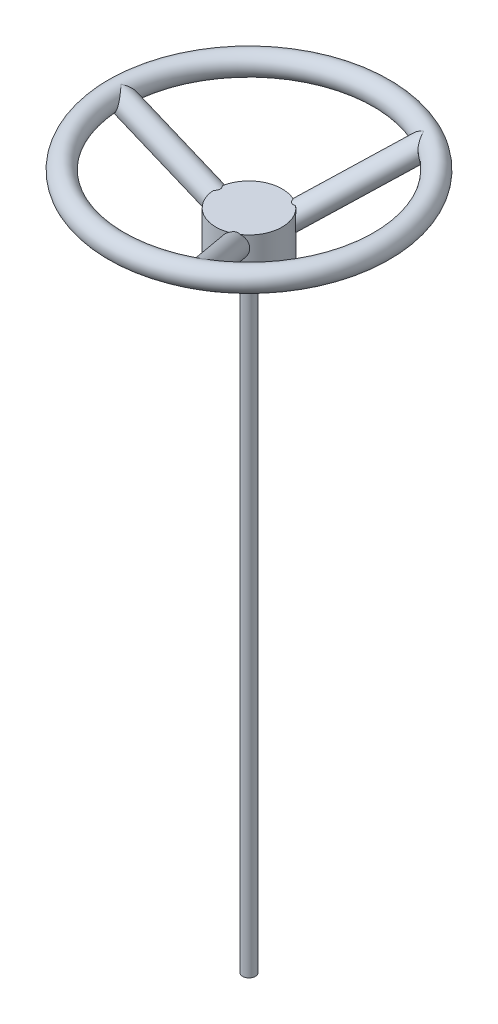
from build123d import *

# Parameters (mm, degrees)
SKETCH1_R           = 12.7
SKETCH4_R           = 38.1
BOSS_EXTRUDE1_DEPTH = 50.8
SWEEP1_PROFILE_R    = 12.7
SKETCH13_R          = 12.7
BOSS_EXTRUDE2_DEPTH = 50.8
CIRPATTERN1_COUNT   = 3
SKETCH20_R          = 7.3025
BOSS_EXTRUDE3_DEPTH = 711.2


with BuildPart() as part:
    # Sketch1 → Revolve1 (revolve)
    with BuildSketch(Plane.XY):
        Circle(SKETCH1_R)
    revolve(axis=Axis((152.4, -24.171508172, 0), (0, 1, 0)))



with BuildPart() as body_2:
    # Sketch4 → Boss-Extrude1 (new body)
    with BuildSketch(Plane(origin=(0, -38.1, 0), x_dir=(1, 0, 0), z_dir=(0, 1, 0))):
        with Locations((152.4, 0)):
            Circle(SKETCH4_R)
    extrude(amount=-BOSS_EXTRUDE1_DEPTH)


with BuildPart() as part_1:
    add(part.part)

    add(body_2.part)  # Sweep1 merges body 2
    # Sweep1: sweep along a curve in space
    with BuildLine() as sweep1_path:
        Line((114.368989505, -50.8, -2.291776762), (0, 0, 0))
    # Sweep1 profile (on start of the path) → Sweep1 (sweep)
    with BuildSketch(Plane(origin=(114.368989505, -50.8, -2.291776762), x_dir=(-0.4059338560019131, -0.9139024589918872, 0), z_dir=(-0.9137492485462624, 0.4058658035458109, 0.01831011450685407))):
        Circle(SWEEP1_PROFILE_R)
    sweep1 = sweep(path=sweep1_path.line)

    # Sketch13 → Boss-Extrude2 (add)
    with BuildSketch(Plane(origin=(114.368989505, -50.8, -2.291776762), x_dir=(-0.016733658672236966, 0.007432695385603842, -0.9998323558010842), z_dir=(0.9137492485462625, -0.40586580354581087, -0.01831011450685408))):
        Circle(SKETCH13_R)
    boss_extrude2 = extrude(amount=BOSS_EXTRUDE2_DEPTH)

    # CirPattern1: Sweep1, Boss-Extrude2 ×3 about axis
    cirpattern1_axis = Axis((152.4, -38.1, 0), (0, 1, 0))
    add([sweep1.rotate(cirpattern1_axis, i * 360 / CIRPATTERN1_COUNT) for i in range(1, CIRPATTERN1_COUNT)])
    add([boss_extrude2.rotate(cirpattern1_axis, i * 360 / CIRPATTERN1_COUNT) for i in range(1, CIRPATTERN1_COUNT)])

    # Sketch20 → Boss-Extrude3 (add)
    with BuildSketch(Plane(origin=(0, -88.9, 0), x_dir=(-1, 0, 0), z_dir=(0, -1, 0))):
        with Locations((-152.4, 0)):
            Circle(SKETCH20_R)
    extrude(amount=BOSS_EXTRUDE3_DEPTH)


solid = part_1.part
